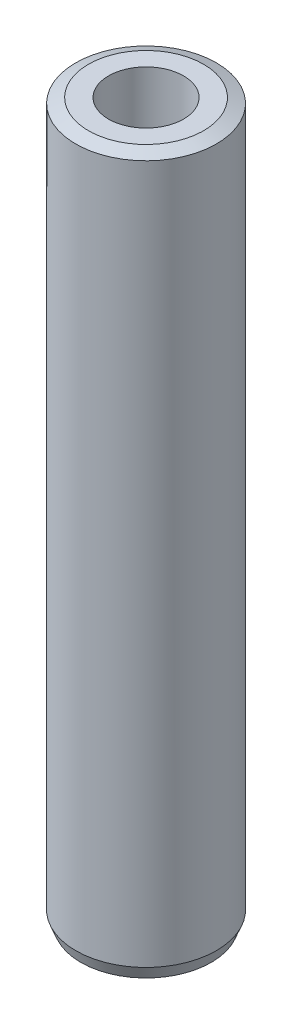
from build123d import *
from OCP.BRepFilletAPI import BRepFilletAPI_MakeChamfer

# Parameters (mm, degrees)
SKETCH1_R           = 12.5
BOSS_EXTRUDE1_DEPTH = 127.312840945
SKETCH2_R           = 6.665168238
CUT_EXTRUDE1_DEPTH  = 129.53427352
CHAMFER1_SIZE       = 0.905588198
CHAMFER1_SIZE2      = 2.266483666


with BuildPart() as part:
    # Sketch1 → Boss-Extrude1 (new body)
    with BuildSketch(Plane(origin=(0, 0, 0), x_dir=(1, 0, 0), z_dir=(0, 1, 0))):
        Circle(SKETCH1_R)
    extrude(amount=BOSS_EXTRUDE1_DEPTH)

    # Sketch2 → Cut-Extrude1 (cut, through all)
    with BuildSketch(Plane(origin=(0, 0, 0), x_dir=(1, 0, 0), z_dir=(0, 1, 0))):
        Circle(SKETCH2_R)
    extrude(amount=CUT_EXTRUDE1_DEPTH, mode=Mode.SUBTRACT)

    # Chamfer1: one chamfer whose edges measure the first distance from different faces: ONE call of the kernel's chamfer builder (chamfer() names one face for all edges)
    chamfer1_edges_1 = [part.edges().sort_by_distance(p)[0] for p in [
        (-12.5, 127.312840945, 0),
    ]]
    chamfer1_side_1 = [part.faces().sort_by_distance(p)[0] for p in [
        (-12.5, 63.656420472, 0),
    ]]
    chamfer1_edges_2 = [part.edges().sort_by_distance(p)[0] for p in [
        (-12.5, 0, 0),
    ]]
    chamfer1_side_2 = [part.faces().sort_by_distance(p)[0] for p in [
        (-12.146446609, 0, 0),
    ]]
    chamfer1 = BRepFilletAPI_MakeChamfer(part.part.solid().wrapped)
    for e in chamfer1_edges_1:
        chamfer1.Add(CHAMFER1_SIZE, CHAMFER1_SIZE2, e.wrapped, chamfer1_side_1[0].wrapped)  # the first distance lies on this face
    for e in chamfer1_edges_2:
        chamfer1.Add(CHAMFER1_SIZE, CHAMFER1_SIZE2, e.wrapped, chamfer1_side_2[0].wrapped)  # the first distance lies on this face
    add(Compound.cast(chamfer1.Shape()), mode=Mode.REPLACE)


solid = part.part
